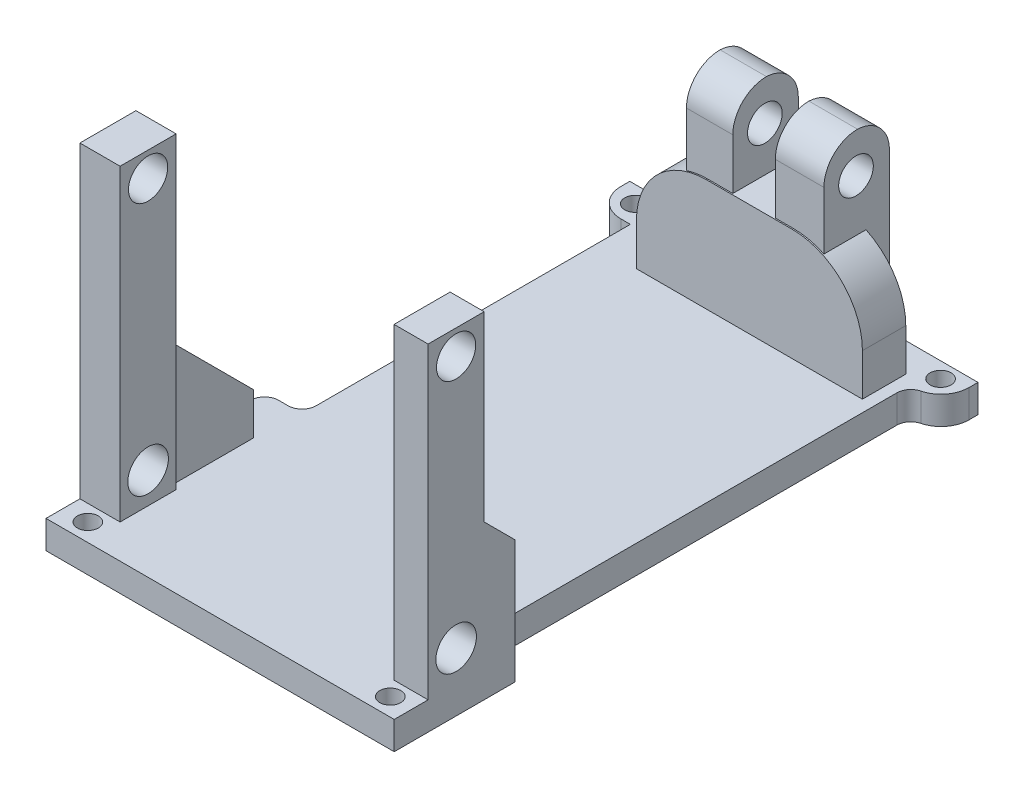
from build123d import *

# Parameters (mm, degrees)
SKETCH_1_W                = 24.86
SKETCH_1_H                = 41.68
SKETCH_1_R                = 0.75
EXTRUDE_2_DEPTH           = 2
SKETCH_4_W                = 2.869231424
SKETCH_4_H                = 4.001531821
SKETCH_4_W_2              = 2.43
SKETCH_4_H_2              = 4
EXTRUDE_3_DEPTH           = 24
SKETCH_8_W                = 3.310255182
SKETCH_8_H                = 4.675588029
SKETCH_8_W_2              = 3.47
EXTRUDE_5_DEPTH           = 16.03
FILLET_5_R                = 2.4
FILLET_6_R                = 2.4
FILLET_7_R                = 2.4
FILLET_8_R                = 2.4
CUT_EXTRUDE_7_DEPTH       = 16.03
CUT_EXTRUDE_7_DEPTH_BACK  = 16.03
SKETCH_13_R               = 1.236878532
CUT_EXTRUDE_8_DEPTH       = 16.03
CUT_EXTRUDE_8_DEPTH_BACK  = 16.03
SKETCH_5_R                = 1.45
CUT_EXTRUDE_9_DEPTH       = 16.03
CUT_EXTRUDE_9_DEPTH_BACK  = 16.03
SKETCH_14_R               = 1.4
SKETCH_16_W               = 16.135324728
SKETCH_16_H               = 3.096678483
EXTRUDE_8_DEPTH           = 10
FILLET_10_R               = 5
FILLET_13_R               = 5
SKETCH_17_W               = 2.433704545
SKETCH_17_H               = 5.946026496
SKETCH_17_W_2             = 1.564461462
SKETCH_17_H_2             = 6
EXTRUDE_9_DEPTH           = 15
CHAMFER_1_SIZE            = 10
CHAMFER_2_SIZE            = 10
CUT_EXTRUDE_16_DEPTH      = 10
CUT_EXTRUDE_16_DEPTH_BACK = 10
SKETCH_19_W               = 2.68
SKETCH_19_H               = 23.433804394
CUT_EXTRUDE_17_DEPTH      = 10
CUT_EXTRUDE_17_DEPTH_BACK = 10
SKETCH_18_W               = 2.24898196
SKETCH_18_H               = 30.410340658
FILLET_17_R               = 2
FILLET_18_R               = 2
FILLET_19_R               = 1


with BuildPart() as part:
    # 草图1 → 凸台-拉伸2 (new body)
    with BuildSketch(Plane(origin=(0, 0, 0), x_dir=(1, 0, 0), z_dir=(0, 1, 0))):
        Rectangle(SKETCH_1_W, SKETCH_1_H)
        with Locations(Location((-10.842762007, 19.642978565, 0), (0, 0, 270))):
            Circle(SKETCH_1_R, mode=Mode.SUBTRACT)
        with Locations(Location((10.87870886, 19.719816311, 0), (0, 0, 270))):
            Circle(SKETCH_1_R, mode=Mode.SUBTRACT)
        with Locations(Location((-10.713936696, -19.568538996, 0), (0, 0, 270))):
            Circle(SKETCH_1_R, mode=Mode.SUBTRACT)
        with Locations(Location((10.87870886, -19.568538996, 0), (0, 0, 270))):
            Circle(SKETCH_1_R, mode=Mode.SUBTRACT)
    extrude(amount=EXTRUDE_2_DEPTH)

    # 草图4 → 凸台-拉伸3 (add)
    with BuildSketch(Plane(origin=(0, 0, 0), x_dir=(1, 0, 0), z_dir=(0, 1, 0))):
        with Locations((-10.995384288, -16.41923409)):
            Rectangle(SKETCH_4_W, SKETCH_4_H)
        with Locations((11.215, -16.42)):
            Rectangle(SKETCH_4_W_2, SKETCH_4_H_2)
    extrude(amount=EXTRUDE_3_DEPTH)

    # 草图8 → 凸台-拉伸5 (add)
    with BuildSketch(Plane(origin=(0, 0, 0), x_dir=(1, 0, 0), z_dir=(0, 1, 0))):
        with Locations((-1.655127591, 18.102205985)):
            Rectangle(SKETCH_8_W, SKETCH_8_H)
        with Locations((4.770502505, 18.102205985)):
            Rectangle(SKETCH_8_W_2, SKETCH_8_H)
    extrude(amount=EXTRUDE_5_DEPTH)

    # 圆角5
    fillet_5_edges = [part.edges().sort_by_distance(p)[0] for p in [
        (-1.655127591, 16.03, -15.764411971),
    ]]
    fillet(fillet_5_edges, radius=FILLET_5_R)

    # 圆角6
    fillet_6_edges = [part.edges().sort_by_distance(p)[0] for p in [
        (4.770502505, 16.03, -15.764411971),
    ]]
    fillet(fillet_6_edges, radius=FILLET_6_R)

    # 圆角7
    # the kernel refuses this fillet: 2.4 mm, written as the material it takes off along each edge
    with BuildSketch(Plane(origin=(-2.956430437, 16.03, -20.44), x_dir=(0, 0, 1), z_dir=(1, 0, 0))) as fillet_7_piece_1_section:
        with BuildLine():
            CenterArc((2.4, 2.396773177), FILLET_7_R, 180, 87.028551133)
            Line((0, 2.396773177), (0, 0))
            Line((0, 0), (2.275588029, 0))
        make_face()
    fillet_7_piece_1 = extrude(amount=15.453865884, mode=Mode.PRIVATE)
    fillet_7_piece_1 = split(fillet_7_piece_1, bisect_by=Plane(origin=(0, 16.03, -20.44), z_dir=(1, 0, 0)), keep=Keep.TOP, mode=Mode.PRIVATE)
    add(fillet_7_piece_1, mode=Mode.SUBTRACT)

    # 圆角8
    # the kernel refuses this fillet: 2.4 mm, written as the material it takes off along each edge
    with BuildSketch(Plane(origin=(-9.302188124, 16.03, -20.44), x_dir=(0, 0, 1), z_dir=(1, 0, 0))) as fillet_8_piece_1:
        with BuildLine():
            CenterArc((2.4, 2.396773177), FILLET_8_R, 180, 87.028551133)
            Line((0, 2.396773177), (-0.048, 2.396773177))
            Line((-0.048, 2.396773177), (-0.048, 0))
            Line((-0.048, 0), (0, -0.048))
            ThreePointArc((0, -0.048), (1.137794014, -0.048), (2.273099789, -0.047935464))
            Line((2.273099789, -0.047935464), (2.275588029, 0))
        make_face()
    extrude(amount=15.294121066, mode=Mode.SUBTRACT)

    # 草图13 → 切除-拉伸7 (cut, two sides: drawn at the far end of the back side and taken through both)
    with BuildSketch(Plane(origin=(0, 0, 0), x_dir=(0, 0, -1), z_dir=(1, 0, 0)).offset(-CUT_EXTRUDE_7_DEPTH_BACK)):
        with Locations(Location((18.052862707, 13.197698645, 0), (0, 0, 180))):
            Circle(SKETCH_13_R)
    extrude(amount=CUT_EXTRUDE_7_DEPTH + CUT_EXTRUDE_7_DEPTH_BACK, mode=Mode.SUBTRACT)

    # 草图5 → 切除-拉伸8 (cut, two sides: drawn at the far end of the back side and taken through both)
    with BuildSketch(Plane(origin=(0, 0, 0), x_dir=(0, 0, -1), z_dir=(1, 0, 0)).offset(-CUT_EXTRUDE_8_DEPTH_BACK)):
        with Locations(Location((-16.419309005, 4.2, 0), (0, 0, 180))):
            Circle(SKETCH_5_R)
    extrude(amount=CUT_EXTRUDE_8_DEPTH + CUT_EXTRUDE_8_DEPTH_BACK, mode=Mode.SUBTRACT)

    # 草图14 → 切除-拉伸9 (cut, two sides: drawn at the far end of the back side and taken through both)
    with BuildSketch(Plane(origin=(0, 0, 0), x_dir=(0, 0, -1), z_dir=(1, 0, 0)).offset(-CUT_EXTRUDE_9_DEPTH_BACK)):
        with Locations(Location((-16.419309005, 22.241125132, 0), (0, 0, 180))):
            Circle(SKETCH_14_R)
    extrude(amount=CUT_EXTRUDE_9_DEPTH + CUT_EXTRUDE_9_DEPTH_BACK, mode=Mode.SUBTRACT)

    # 草图16 → 凸台-拉伸8 (add)
    with BuildSketch(Plane(origin=(0, 0, 0), x_dir=(1, 0, 0), z_dir=(0, 1, 0))):
        with Locations((1.276700778, 17.221878583)):
            Rectangle(SKETCH_16_W, SKETCH_16_H)
    extrude(amount=EXTRUDE_8_DEPTH)

    # 圆角10
    fillet_10_edges = [part.edges().sort_by_distance(p)[0] for p in [
        (-6.790961586, 10, -17.221878582),
    ]]
    fillet(fillet_10_edges, radius=FILLET_10_R)

    # 圆角13
    fillet_13_edges = [part.edges().sort_by_distance(p)[0] for p in [
        (9.344363142, 10, -17.221878582),
    ]]
    fillet(fillet_13_edges, radius=FILLET_13_R)

    # 草图17 → 凸台-拉伸9 (add)
    with BuildSketch(Plane(origin=(0, 0, 0), x_dir=(1, 0, 0), z_dir=(0, 1, 0))):
        with Locations((-11.213147728, -11.445454931)):
            Rectangle(SKETCH_17_W, SKETCH_17_H)
        with Locations((11.647769269, -11.42)):
            Rectangle(SKETCH_17_W_2, SKETCH_17_H_2)
    extrude(amount=EXTRUDE_9_DEPTH)

    # 倒角1
    # the kernel refuses this chamfer: 10 mm, written as the material it takes off along each edge
    with BuildSketch(Plane(origin=(-38.14682988, 15, 8.472441683), x_dir=(0, 0, 1), z_dir=(1, 0, 0))) as chamfer_1_piece_1_section:
        Polygon((CHAMFER_1_SIZE, 0), (0, CHAMFER_1_SIZE), (0, 0), align=None)
    chamfer_1_piece_1 = extrude(amount=53.867364305, mode=Mode.PRIVATE)
    chamfer_1_piece_1 = split(chamfer_1_piece_1, bisect_by=Plane(origin=(-38.14682988, 15, 14.418468179), z_dir=(0, 0, -1)), keep=Keep.TOP, mode=Mode.PRIVATE)
    chamfer_1_piece_1 = split(chamfer_1_piece_1, bisect_by=Plane(origin=(10, 15, 8.472441683), z_dir=(-1, 0, 0)), keep=Keep.TOP, mode=Mode.PRIVATE)
    add(chamfer_1_piece_1, mode=Mode.SUBTRACT)

    # 倒角2
    # the kernel refuses this chamfer: 10 mm, written as the material it takes off along each edge
    with BuildSketch(Plane(origin=(38.14682988, 15, 8.42), x_dir=(0, 0, 1), z_dir=(-1, 0, 0))) as chamfer_2_piece_1_section:
        Polygon((CHAMFER_2_SIZE, 0), (0, -CHAMFER_2_SIZE), (0, 0), align=None)
    chamfer_2_piece_1 = extrude(amount=52.998121222, mode=Mode.PRIVATE)
    chamfer_2_piece_1 = split(chamfer_2_piece_1, bisect_by=Plane(origin=(38.14682988, 15, 14.42), z_dir=(0, 0, -1)), keep=Keep.TOP, mode=Mode.PRIVATE)
    chamfer_2_piece_1 = split(chamfer_2_piece_1, bisect_by=Plane(origin=(10, 15, 8.42), z_dir=(1, 0, 0)), keep=Keep.TOP, mode=Mode.PRIVATE)
    add(chamfer_2_piece_1, mode=Mode.SUBTRACT)

    # 草图19 → 切除-拉伸16 (cut, two sides: drawn at the far end of the back side and taken through both)
    with BuildSketch(Plane(origin=(0, 0, 0), x_dir=(1, 0, 0), z_dir=(0, 1, 0)).offset(-CUT_EXTRUDE_16_DEPTH_BACK)):
        with Locations((-11.09, 6.483097803)):
            Rectangle(SKETCH_19_W, SKETCH_19_H)
    extrude(amount=CUT_EXTRUDE_16_DEPTH + CUT_EXTRUDE_16_DEPTH_BACK, mode=Mode.SUBTRACT)

    # 草图18 → 切除-拉伸17 (cut, two sides: drawn at the far end of the back side and taken through both)
    with BuildSketch(Plane(origin=(0, 0, 0), x_dir=(1, 0, 0), z_dir=(0, 1, 0)).offset(-CUT_EXTRUDE_17_DEPTH_BACK)):
        with Locations((11.30550902, 2.994829671)):
            Rectangle(SKETCH_18_W, SKETCH_18_H)
    extrude(amount=CUT_EXTRUDE_17_DEPTH + CUT_EXTRUDE_17_DEPTH_BACK, mode=Mode.SUBTRACT)

    # 圆角17
    fillet_17_edges = [part.edges().sort_by_distance(p)[0] for p in [
        (12.43, 1, -18.2),
    ]]
    fillet(fillet_17_edges, radius=FILLET_17_R)

    # 圆角18
    fillet_18_edges = [part.edges().sort_by_distance(p)[0] for p in [
        (-12.43, 1, -18.2),
    ]]
    fillet(fillet_18_edges, radius=FILLET_18_R)

    # 圆角19
    fillet_19_edges = [part.edges().sort_by_distance(p)[0] for p in [
        (10.18101804, 1, -18.2),
        (10.18101804, 1, 12.210340658),
        (-12.43, 1, 5.233804394),
        (-9.75, 1, 5.233804394),
    ]]
    fillet(fillet_19_edges, radius=FILLET_19_R)


solid = part.part
